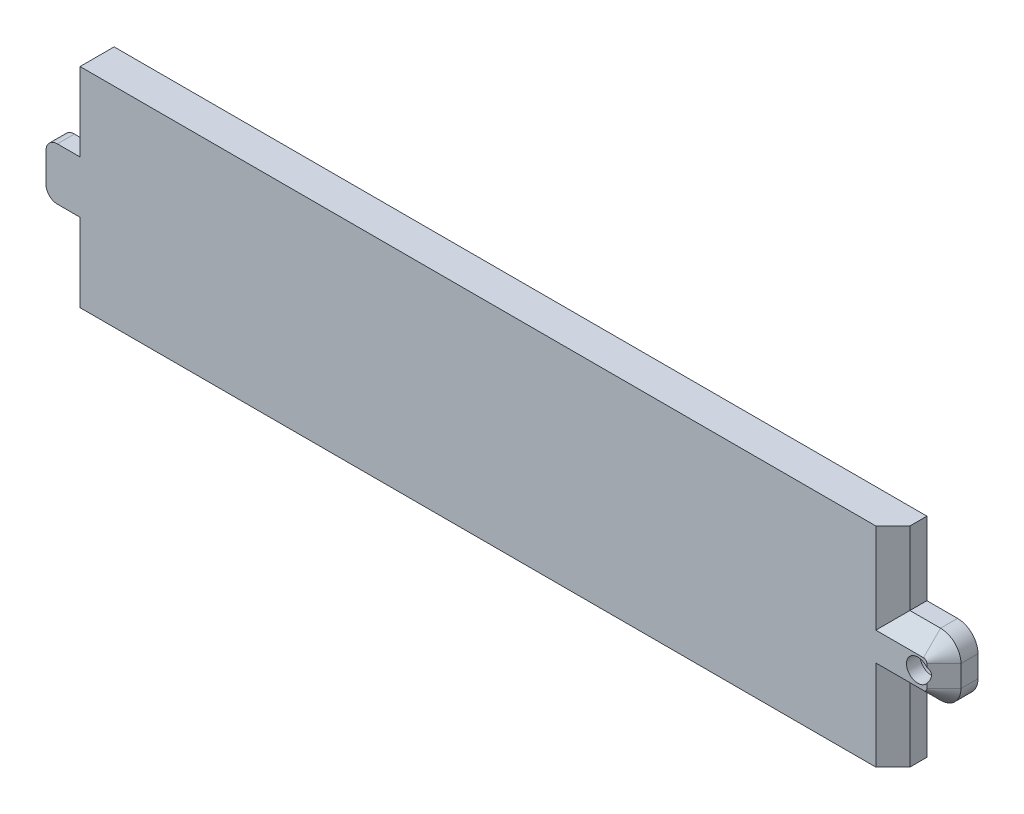
from build123d import *

# Parameters (mm, degrees)
SKETCH_1_W          = 71.6
SKETCH_1_H          = 18.4
EXTRUDE_1_DEPTH     = 3
SKETCH_3_R          = 1
EXTRUDE_2_DEPTH     = 3
SKETCH_4_R          = 1.85
CUT_EXTRUDE_1_DEPTH = 1.8
EXTRUDE_START       = -1.5
EXTRUDE_3_DEPTH     = 1.5
CHAMFER_1_SIZE      = 1.5


with BuildPart() as part:
    # 草图1 → 凸台-拉伸1 (new body)
    with BuildSketch(Plane.XY):
        Rectangle(SKETCH_1_W, SKETCH_1_H)
    extrude(amount=EXTRUDE_1_DEPTH)

    # 草图3 → 凸台-拉伸2 (add)
    with BuildSketch(Plane(origin=(0, 0, 0), x_dir=(-1, 0, 0), z_dir=(0, 0, -1))):
        with BuildLine():
            Line((-31.3, 2.75), (-38.5, 2.75))
            ThreePointArc((-38.5, 2.75), (-39.772792206, 2.222792206), (-40.3, 0.95))
            Line((-40.3, 0.95), (-40.3, -0.95))
            ThreePointArc((-40.3, -0.95), (-39.772792206, -2.222792206), (-38.5, -2.75))
            Line((-38.5, -2.75), (-31.3, -2.75))
            Line((-31.3, -2.75), (-31.3, 2.75))
        make_face()
        with Locations((-38, 0.05)):
            Circle(SKETCH_3_R, mode=Mode.SUBTRACT)
    extrude(amount=-EXTRUDE_2_DEPTH)

    # 草图4 → 切除-拉伸1 (cut)
    with BuildSketch(Plane(origin=(0, 0, 0), x_dir=(-1, 0, 0), z_dir=(0, 0, -1))):
        with Locations((-38, 0.05)):
            Circle(SKETCH_4_R)
    extrude(amount=-CUT_EXTRUDE_1_DEPTH, mode=Mode.SUBTRACT)

    # 草图5 → 凸台-拉伸3 (add)
    with BuildSketch(Plane(origin=(0, 0, 0), x_dir=(-1, 0, 0), z_dir=(0, 0, -1)).offset(EXTRUDE_START)):
        with BuildLine():
            Line((37.8, 2.3), (35.8, 2.3))
            Line((35.8, 2.3), (35.8, -2.3))
            Line((35.8, -2.3), (37.8, -2.3))
            ThreePointArc((37.8, -2.3), (38.507106781, -2.007106781), (38.8, -1.3))
            Line((38.8, -1.3), (38.8, 1.3))
            ThreePointArc((38.8, 1.3), (38.507106781, 2.007106781), (37.8, 2.3))
        make_face()
    extrude(amount=-EXTRUDE_3_DEPTH)

    # 倒角1
    # the kernel refuses this chamfer: 1.5 mm, written as the material it takes off along each edge
    with BuildSketch(Plane(origin=(35.8, 13.057524482, 3), x_dir=(0.027495876610586778, 0, -0.9996219169112968), z_dir=(0, -1, 0))) as chamfer_1_piece_1:
        Polygon((CHAMFER_1_SIZE * 0.999621916911, -CHAMFER_1_SIZE * 0.0274958766106), (-CHAMFER_1_SIZE * 0.0274958766106, -CHAMFER_1_SIZE * 0.999621916911), (0, 0), align=None)
    extrude(amount=10.307524482, mode=Mode.SUBTRACT)
    with BuildSketch(Plane(origin=(38.5, -2.75, 3), x_dir=(0, 0.9996219169112968, 0.02749587661058649), z_dir=(-1, 0, 0)), Plane(origin=(35.8, 2.75, 3), x_dir=(0, -0.9996219169112968, 0.02749587661058649), z_dir=(1, 0, 0))) as chamfer_1_piece_2:
        Polygon((CHAMFER_1_SIZE * 0.999621916911, CHAMFER_1_SIZE * 0.0274958766106), (-CHAMFER_1_SIZE * 0.0274958766106, CHAMFER_1_SIZE * 0.999621916911), (0, 0), align=None)
    extrude(amount=2.7, mode=Mode.SUBTRACT)
    with BuildSketch(Plane(origin=(38.5, -0.95, 3), x_dir=(1, 0, 0), z_dir=(0, 1, 0))) as chamfer_1_piece_3:
        Polygon((1.8 - CHAMFER_1_SIZE, 0), (1.8, CHAMFER_1_SIZE), (1.8, 0), align=None)
    revolve(axis=Axis((38.5, -0.95, 3), (0, 0, -1)), revolution_arc=90, mode=Mode.SUBTRACT)
    with BuildSketch(Plane(origin=(40.3, 0.95, 3), x_dir=(-0.9996219169112968, 0, 0.02749587661058648), z_dir=(0, -1, 0))) as chamfer_1_piece_4:
        Polygon((CHAMFER_1_SIZE * 0.999621916911, CHAMFER_1_SIZE * 0.0274958766106), (-CHAMFER_1_SIZE * 0.0274958766106, CHAMFER_1_SIZE * 0.999621916911), (0, 0), align=None)
    extrude(amount=1.9, mode=Mode.SUBTRACT)
    with BuildSketch(Plane(origin=(38.5, 0.95, 3), x_dir=(0, 1, 0), z_dir=(-1, 0, 0))) as chamfer_1_piece_5:
        Polygon((1.8 - CHAMFER_1_SIZE, 0), (1.8, CHAMFER_1_SIZE), (1.8, 0), align=None)
    revolve(axis=Axis((38.5, 0.95, 3), (0, 0, -1)), revolution_arc=90, mode=Mode.SUBTRACT)
    with BuildSketch(Plane(origin=(35.8, -2.75, 3), x_dir=(-0.9996219169112968, 0, 0.02749587661058648), z_dir=(0, -1, 0))) as chamfer_1_piece_6:
        Polygon((CHAMFER_1_SIZE * 0.999621916911, CHAMFER_1_SIZE * 0.0274958766106), (-CHAMFER_1_SIZE * 0.0274958766106, CHAMFER_1_SIZE * 0.999621916911), (0, 0), align=None)
    extrude(amount=10.307524482, mode=Mode.SUBTRACT)
    with BuildSketch(Plane(origin=(35.8, 13.057524482, 3), x_dir=(0.027495876610586778, 0, -0.9996219169112968), z_dir=(0, -1, 0))) as chamfer_1_piece_7a_section:
        Polygon((CHAMFER_1_SIZE * 0.999621916911, -CHAMFER_1_SIZE * 0.0274958766106), (-CHAMFER_1_SIZE * 0.0274958766106, -CHAMFER_1_SIZE * 0.999621916911), (0, 0), align=None)
    chamfer_1_piece_7a = extrude(amount=14.165048964, mode=Mode.PRIVATE)
    chamfer_1_piece_7a = split(chamfer_1_piece_7a, bisect_by=Plane(origin=(35.30530956, 2.75, 2.50530956), z_dir=(0, -1, 0)), keep=Keep.TOP, mode=Mode.PRIVATE)
    with BuildSketch(Plane(origin=(31.942475518, 2.75, 3), x_dir=(0, -0.9996219169112968, 0.02749587661058649), z_dir=(1, 0, 0))) as chamfer_1_piece_7b_section:
        Polygon((CHAMFER_1_SIZE * 0.999621916911, CHAMFER_1_SIZE * 0.0274958766106), (-CHAMFER_1_SIZE * 0.0274958766106, CHAMFER_1_SIZE * 0.999621916911), (0, 0), align=None)
    chamfer_1_piece_7b = extrude(amount=6.557524482, mode=Mode.PRIVATE)
    chamfer_1_piece_7b = split(chamfer_1_piece_7b, bisect_by=Plane(origin=(35.8, 2.25530956, 2.50530956), z_dir=(-1, 0, 0)), keep=Keep.TOP, mode=Mode.PRIVATE)
    chamfer_1_piece_7 = chamfer_1_piece_7a & chamfer_1_piece_7b
    add(chamfer_1_piece_7, mode=Mode.SUBTRACT)
    with BuildSketch(Plane(origin=(38.5, -2.75, 3), x_dir=(0, 0.9996219169112968, 0.02749587661058649), z_dir=(-1, 0, 0))) as chamfer_1_piece_8a_section:
        Polygon((CHAMFER_1_SIZE * 0.999621916911, CHAMFER_1_SIZE * 0.0274958766106), (-CHAMFER_1_SIZE * 0.0274958766106, CHAMFER_1_SIZE * 0.999621916911), (0, 0), align=None)
    chamfer_1_piece_8a = extrude(amount=6.557524482, mode=Mode.PRIVATE)
    chamfer_1_piece_8a = split(chamfer_1_piece_8a, bisect_by=Plane(origin=(35.8, -2.25530956, 2.50530956), z_dir=(-1, 0, 0)), keep=Keep.TOP, mode=Mode.PRIVATE)
    with BuildSketch(Plane(origin=(35.8, 1.107524482, 3), x_dir=(-0.9996219169112968, 0, 0.02749587661058648), z_dir=(0, -1, 0))) as chamfer_1_piece_8b_section:
        Polygon((CHAMFER_1_SIZE * 0.999621916911, CHAMFER_1_SIZE * 0.0274958766106), (-CHAMFER_1_SIZE * 0.0274958766106, CHAMFER_1_SIZE * 0.999621916911), (0, 0), align=None)
    chamfer_1_piece_8b = extrude(amount=14.165048964, mode=Mode.PRIVATE)
    chamfer_1_piece_8b = split(chamfer_1_piece_8b, bisect_by=Plane(origin=(35.30530956, -2.75, 2.50530956), z_dir=(0, 1, 0)), keep=Keep.TOP, mode=Mode.PRIVATE)
    chamfer_1_piece_8 = chamfer_1_piece_8a & chamfer_1_piece_8b
    add(chamfer_1_piece_8, mode=Mode.SUBTRACT)


solid = part.part
